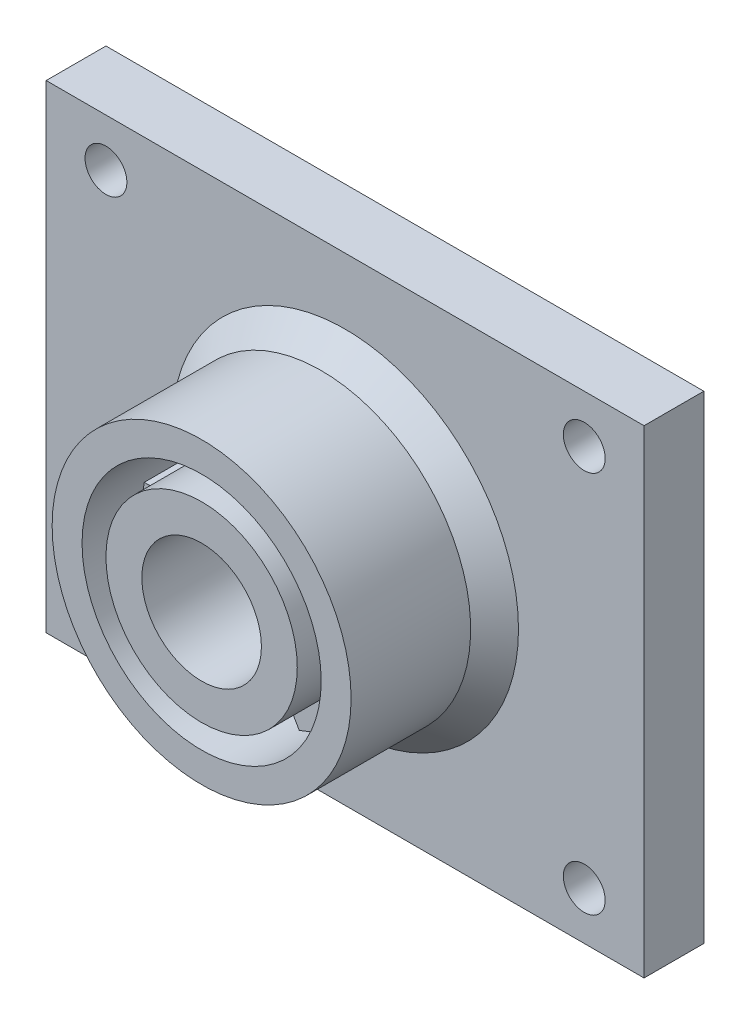
from build123d import *
from build123d.topology import SkipClean

# Parameters (mm, degrees)
CROQUIS1_W              = 50
CROQUIS1_H              = 40
CROQUIS1_R              = 1.75
SALIENTE_EXTRUIR1_DEPTH = 2.5
CROQUIS2_R              = 12.5
CROQUIS2_R_2            = 5
SALIENTE_EXTRUIR2_DEPTH = 7
CROQUIS4_R              = 12.5
CROQUIS4_R_2            = 10
CROQUIS4_R_3            = 8
CROQUIS4_R_4            = 5
SALIENTE_EXTRUIR3_DEPTH = 5
CHAFL_N1_SIZE           = 2


with BuildPart() as part:
    # Croquis1 → Saliente-Extruir1 (new, symmetric)
    with BuildSketch(Plane.XY):
        Rectangle(CROQUIS1_W, CROQUIS1_H)
        with Locations((-20, 16)):
            Circle(CROQUIS1_R, mode=Mode.SUBTRACT)
        with Locations((20, 16)):
            Circle(CROQUIS1_R, mode=Mode.SUBTRACT)
        with Locations((20, -16)):
            Circle(CROQUIS1_R, mode=Mode.SUBTRACT)
        with Locations((-20, -16)):
            Circle(CROQUIS1_R, mode=Mode.SUBTRACT)
    extrude(amount=SALIENTE_EXTRUIR1_DEPTH, both=True)

    # Croquis2 → Saliente-Extruir2 (add)
    with BuildSketch(Plane.XY.offset(2.5)):
        Circle(CROQUIS2_R)
        with BuildLine():
            Line((-7.745966692, 2), (-9.797958971, 2))
            ThreePointArc((-9.797958971, 2), (-8.660254038, 5), (-6.631030293, 7.485281374))
            Line((-6.631030293, 7.485281374), (-5.605034154, 5.708203932))
            ThreePointArc((-5.605034154, 5.708203932), (-6.92820323, 4), (-7.745966692, 2))
        make_face(mode=Mode.SUBTRACT)
        with BuildLine():
            Line((-9.797958971, -2), (-7.745966692, -2))
            ThreePointArc((-7.745966692, -2), (-6.92820323, -4), (-5.605034154, -5.708203932))
            Line((-5.605034154, -5.708203932), (-6.631030293, -7.485281374))
            ThreePointArc((-6.631030293, -7.485281374), (-8.660254038, -5), (-9.797958971, -2))
        make_face(mode=Mode.SUBTRACT)
        with BuildLine():
            ThreePointArc((3.166928678, -9.485281374), (0, -10), (-3.166928678, -9.485281374))
            Line((-3.166928678, -9.485281374), (-2.140932539, -7.708203932))
            ThreePointArc((-2.140932539, -7.708203932), (0, -8), (2.140932539, -7.708203932))
            Line((2.140932539, -7.708203932), (3.166928678, -9.485281374))
        make_face(mode=Mode.SUBTRACT)
        with BuildLine():
            ThreePointArc((9.797958971, -2), (8.660254038, -5), (6.631030293, -7.485281374))
            Line((6.631030293, -7.485281374), (5.605034154, -5.708203933))
            ThreePointArc((5.605034154, -5.708203933), (6.92820323, -4), (7.745966692, -2))
            Line((7.745966692, -2), (9.797958971, -2))
        make_face(mode=Mode.SUBTRACT)
        with BuildLine():
            ThreePointArc((6.631030293, 7.485281374), (8.660254038, 5), (9.797958971, 2))
            Line((9.797958971, 2), (7.745966692, 2))
            ThreePointArc((7.745966692, 2), (6.92820323, 4), (5.605034154, 5.708203932))
            Line((5.605034154, 5.708203932), (6.631030293, 7.485281374))
        make_face(mode=Mode.SUBTRACT)
        with BuildLine():
            ThreePointArc((-3.166928678, 9.485281374), (0, 10), (3.166928678, 9.485281374))
            Line((3.166928678, 9.485281374), (2.140932539, 7.708203932))
            ThreePointArc((2.140932539, 7.708203932), (0, 8), (-2.140932539, 7.708203932))
            Line((-2.140932539, 7.708203932), (-3.166928678, 9.485281374))
        make_face(mode=Mode.SUBTRACT)
        Circle(CROQUIS2_R_2, mode=Mode.SUBTRACT)
    extrude(amount=SALIENTE_EXTRUIR2_DEPTH)

    # Croquis4 → Saliente-Extruir3 (add)
    # profile 1 of 2: a face of its own
    with SkipClean():  # the faces are left unmerged after this step: merging them gives an invalid solid
        with BuildSketch(Plane.XY.offset(9.5)):
            Circle(CROQUIS4_R)
            Circle(CROQUIS4_R_2, mode=Mode.SUBTRACT)
        # profile 2 of 2: a face of its own
        with BuildSketch(Plane.XY.offset(9.5)):
            Circle(CROQUIS4_R_3)
            Circle(CROQUIS4_R_4, mode=Mode.SUBTRACT)
        extrude(amount=SALIENTE_EXTRUIR3_DEPTH)

    # Chaflán1
    chafl_n1_edges = [part.edges().sort_by_distance(p)[0] for p in [
        (-12.5, 0, 2.5),
    ]]
    chamfer(chafl_n1_edges, length=CHAFL_N1_SIZE)


solid = part.part
